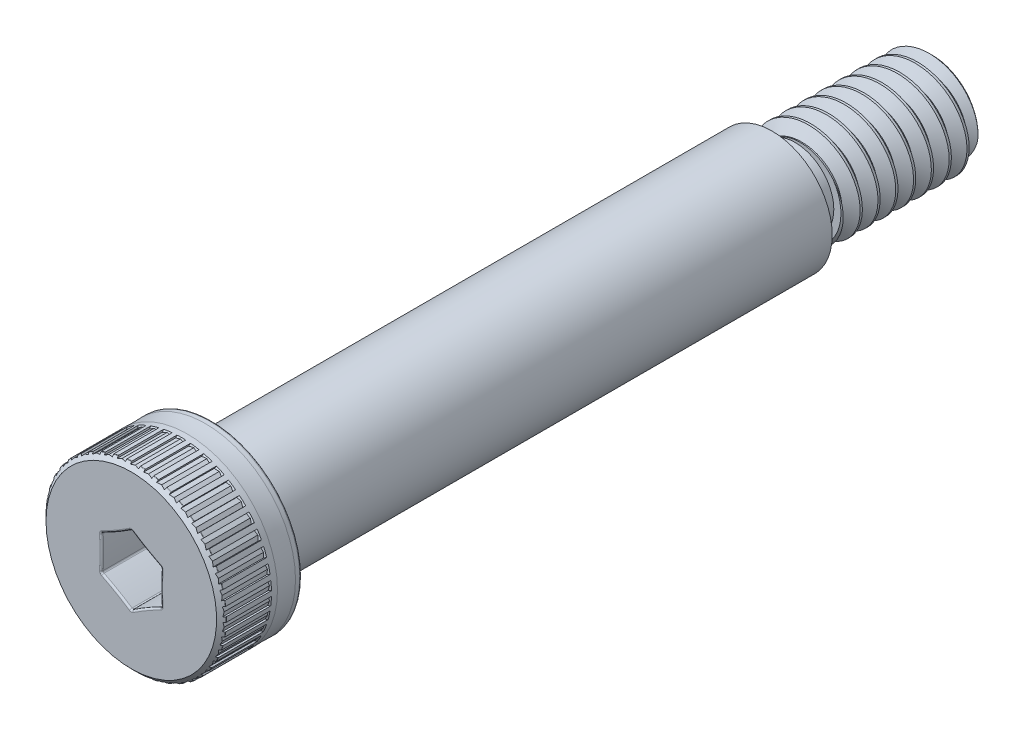
from build123d import *

# Parameters (mm, degrees)
SKETCH4_W             = 1.5875
SKETCH4_H             = 0.47625
SKETCH4_W_2           = 1.834444444
SKETCH4_H_2           = 0.916543552
CHAMFER1_SIZE         = 0.47625
FILLET1_R             = 0.28575
FILLET2_R             = 0.282222222
CHAMFER2_SIZE         = 0.352777778
CHAMFER3_SIZE         = 0.381
CUT_EXTRUDE1_DEPTH    = 3.9751
FILLET4_R             = 0.142875
DELETEFACE1_START     = -46.284444444
DELETEFACE1_OUTLINE_W = 10
DELETEFACE1_OUTLINE_H = 10
DELETEFACE1_OUTLINE_R = 3.058556448
DELETEFACE1_DEPTH     = 0.282222322
CUT_SWEEP1_PITCH      = 1.411111111
CUT_EXTRUDE2_REACH    = 66.299
CIRPATTERN1_COUNT     = 42
FILLET5_R             = 0.0508


# Read off the part's stored shape, not the designer's step: DeleteFace1, CirPattern2
with BuildPart() as part:
    # Sketch3 → Revolve1 (revolve)
    with BuildSketch(Plane(origin=(0, 0, 0), x_dir=(0, 0, -1), z_dir=(1, 0, 0)), mode=Mode.PRIVATE) as revolve1_sk:
        Polygon((-6.35, 7.14375), (0, 7.14375), (0, 4.7625), (44.45, 4.7625), (44.45, 3.9751), (57.15, 3.9751), (57.15, 0), (-6.35, 0), align=None)
    revolve(revolve1_sk.sketch.rotate(Axis((0, 0, 6.35), (0, 0, -1)), 90), axis=Axis((0, 0, 6.35), (0, 0, -1)))

    # Sketch4 → Cut-Revolve1 (revolve, cut)
    with BuildSketch(Plane(origin=(0, 0, 0), x_dir=(0, 0, -1), z_dir=(1, 0, 0)), mode=Mode.PRIVATE) as cut_revolve1_sk:
        with Locations((0.79375, 4.524375)):
            Rectangle(SKETCH4_W, SKETCH4_H)
        with Locations((45.367222222, 3.516828224)):
            Rectangle(SKETCH4_W_2, SKETCH4_H_2)
    revolve(cut_revolve1_sk.sketch.rotate(Axis((0, 0, 6.35), (0, 0, -1)), 90), axis=Axis((0, 0, 6.35), (0, 0, -1)), mode=Mode.SUBTRACT)

    # Chamfer1
    chamfer1_edges = [part.edges().sort_by_distance(p)[0] for p in [
        (-4.28625, 0, -1.5875),
    ]]
    chamfer(chamfer1_edges, length=CHAMFER1_SIZE - 0.0001)  # a hair under: the kernel refuses the full size

    # Fillet1
    fillet1_edges = [part.edges().sort_by_distance(p)[0] for p in [
        (-4.28625, 0, 0),
    ]]
    fillet(fillet1_edges, radius=FILLET1_R)

    # Fillet2
    fillet2_edges = [part.edges().sort_by_distance(p)[0] for p in [
        (-3.058556448, 0, -44.45),
        (-3.058556448, 0, -46.284444444),
    ]]
    fillet(fillet2_edges, radius=FILLET2_R)

    # Chamfer2
    chamfer2_edges = [part.edges().sort_by_distance(p)[0] for p in [
        (-3.9751, 0, -46.284444444),
        (-3.9751, 0, -57.15),
    ]]
    chamfer(chamfer2_edges, length=CHAMFER2_SIZE)

    # Chamfer3
    chamfer3_edges = [part.edges().sort_by_distance(p)[0] for p in [
        (-7.14375, 0, 6.35),
    ]]
    chamfer(chamfer3_edges, length=CHAMFER3_SIZE)

    # Sketch5 → Cut-Extrude1 (cut)
    with BuildSketch(Plane.XY.offset(6.35)):
        with BuildLine():
            ThreePointArc((2.38125, 1.374815329), (1.1668125, 2.020978533), (0, 2.749630657))
            ThreePointArc((0, 2.749630657), (-1.1668125, 2.020978533), (-2.38125, 1.374815329))
            ThreePointArc((-2.38125, 1.374815329), (-2.333625, 0), (-2.38125, -1.374815329))
            ThreePointArc((-2.38125, -1.374815329), (-1.1668125, -2.020978533), (0, -2.749630657))
            ThreePointArc((0, -2.749630657), (1.1668125, -2.020978533), (2.38125, -1.374815329))
            ThreePointArc((2.38125, -1.374815329), (2.333625, 0), (2.38125, 1.374815329))
        make_face()
    extrude(amount=-CUT_EXTRUDE1_DEPTH, mode=Mode.SUBTRACT)

    # Fillet4
    fillet4_edges = [part.edges().sort_by_distance(p)[0] for p in [
        (2.333625, 0, 2.3749),
        (2.38125, 1.374815329, 4.36245),
        (1.1668125, -2.020978533, 2.3749),
        (2.38125, -1.374815329, 4.36245),
        (-1.1668125, -2.020978533, 2.3749),
        (0, -2.749630657, 4.36245),
        (-2.333625, 0, 2.3749),
        (-2.38125, -1.374815329, 4.36245),
        (-1.1668125, 2.020978533, 2.3749),
        (-2.38125, 1.374815329, 4.36245),
        (1.1668125, 2.020978533, 2.3749),
        (0, 2.749630657, 4.36245),
        (2.333625, 0, 6.35),
        (1.1668125, 2.020978533, 6.35),
        (-1.1668125, 2.020978533, 6.35),
        (-2.333625, 0, 6.35),
        (-1.1668125, -2.020978533, 6.35),
        (1.1668125, -2.020978533, 6.35),
        (-7.14375, 0, 0),
    ]]
    fillet(fillet4_edges, radius=FILLET4_R)

    # DeleteFace1 outline → DeleteFace1 (cut)
    with BuildSketch(Plane.XY.offset(DELETEFACE1_START)):
        Rectangle(DELETEFACE1_OUTLINE_W, DELETEFACE1_OUTLINE_H)
        Circle(DELETEFACE1_OUTLINE_R, mode=Mode.SUBTRACT)
    extrude(amount=DELETEFACE1_DEPTH, mode=Mode.SUBTRACT)

    # Cut-Sweep1: the profile of Sketch7 profile screwed along a right-hand helix of 8.48 turns, 8 arcs to a turn; built about Z, then put on its axis
    cut_sweep1_z = Axis((0, 0, 0), (0, 0, 1))
    cut_sweep1_corners = [(4.051478629, 0, 0.044097222), (4.051478629, 0, -1.278819444), (3.058256448, 0, -0.70538235), (3.058256448, 0, -0.529339872)]
    with BuildLine(mode=Mode.PRIVATE) as cut_sweep1_profile:
        Line(cut_sweep1_corners[0], cut_sweep1_corners[1])
        Line(cut_sweep1_corners[1], cut_sweep1_corners[2])
        Line(cut_sweep1_corners[2], cut_sweep1_corners[3])
        Line(cut_sweep1_corners[3], cut_sweep1_corners[0])
    cut_sweep1_cap = Face(cut_sweep1_profile.wire())
    cut_sweep1_turn_angles = [0, 22.5, 45, 67.5, 90, 112.5, 135, 157.5, 180, 202.5, 225, 247.5, 270, 292.5, 315, 337.5, 360]
    cut_sweep1_turn_weights = [1, 0.9238795325112867, 1, 0.9238795325112867, 1, 0.9238795325112867, 1, 0.9238795325112867, 1, 0.9238795325112867, 1, 0.9238795325112867, 1, 0.9238795325112867, 1, 0.9238795325112867, 1]
    cut_sweep1_turn_rails = [Edge.make_bspline([Vector(p[0], p[1], 0).rotate(cut_sweep1_z, cut_sweep1_turn_angles[k]) / cut_sweep1_turn_weights[k] + Vector(0, 0, p[2] + CUT_SWEEP1_PITCH * cut_sweep1_turn_angles[k] / 360) for k in range(17)], [0, 0, 0, 1, 1, 2, 2, 3, 3, 4, 4, 5, 5, 6, 6, 7, 7, 8, 8, 8], 2, cut_sweep1_turn_weights) for p in cut_sweep1_corners]
    cut_sweep1_turn_sides = [Face.make_surface_from_curves(cut_sweep1_turn_rails[p[0]], cut_sweep1_turn_rails[p[1]]) for p in [(0, 1), (1, 2), (2, 3), (3, 0)]]
    cut_sweep1_last_angles = [2880, 2902.5, 2925, 2947.5, 2970, 2992.5, 3015, 3033.9, 3052.8]
    cut_sweep1_last_weights = [1, 0.9238795325112867, 1, 0.9238795325112867, 1, 0.9238795325112867, 1, 0.9460853588276014, 1]
    cut_sweep1_last_rails = [Edge.make_bspline([Vector(p[0], p[1], 0).rotate(cut_sweep1_z, cut_sweep1_last_angles[k]) / cut_sweep1_last_weights[k] + Vector(0, 0, p[2] + CUT_SWEEP1_PITCH * cut_sweep1_last_angles[k] / 360) for k in range(9)], [0, 0, 0, 1, 1, 2, 2, 3, 3, 4, 4, 4], 2, cut_sweep1_last_weights) for p in cut_sweep1_corners]
    cut_sweep1_last_sides = [Face.make_surface_from_curves(cut_sweep1_last_rails[p[0]], cut_sweep1_last_rails[p[1]]) for p in [(0, 1), (1, 2), (2, 3), (3, 0)]]
    cut_sweep1 = Plane(origin=(0, 0, -57.15), x_dir=(0, 1, 0), z_dir=(0, 0, 1)) * Solid(Shell([*[p.moved(Location((0, 0, CUT_SWEEP1_PITCH * i))) for i in range(8) for p in cut_sweep1_turn_sides], *cut_sweep1_last_sides, cut_sweep1_cap, cut_sweep1_cap.rotate(cut_sweep1_z, 3052.8).moved(Location((0, 0, CUT_SWEEP1_PITCH * 3052.8 / 360)))]))
    add(cut_sweep1, mode=Mode.SUBTRACT)

    # Cut-Extrude2: up to this plane
    cut_extrude2_end = Plane(origin=(0, 8.546915019, 0.978084981), z_dir=(0, 0.707106781186546, 0.7071067811865491))
    # Sketch8 → Cut-Extrude2 (cut, up to the surface)
    with BuildSketch(Plane.XY.offset(6.35), mode=Mode.PRIVATE) as cut_extrude2_sk1:
        Polygon((-0.3429, 7.14375), (0.3429, 7.14375), (0.328483903, 7.00659), (0, 7.07517), (-0.328483903, 7.00659), align=None)
    cut_extrude2_tool1 = split(extrude(cut_extrude2_sk1.sketch, amount=-CUT_EXTRUDE2_REACH, mode=Mode.PRIVATE), bisect_by=cut_extrude2_end, keep=Keep.BOTH, mode=Mode.PRIVATE)
    cut_extrude2 = cut_extrude2_tool1.solids().sort_by_distance((0, 7.090627, 6.35))[0]
    add(cut_extrude2, mode=Mode.SUBTRACT)

    # CirPattern1: Cut-Extrude2 ×42 about axis
    cirpattern1_axis = Axis((0, 0, 0), (0, 0, 1))
    for i in range(1, CIRPATTERN1_COUNT):
        add(cut_extrude2.rotate(cirpattern1_axis, i * 360 / CIRPATTERN1_COUNT), mode=Mode.SUBTRACT)

    # Fillet5
    fillet5_edges = [part.edges().sort_by_distance(p)[0] for p in [
        (0.533853106, 7.123774626, 5.969),
    ]]
    fillet(fillet5_edges, radius=FILLET5_R)

    # CirPattern2 outline → CirPattern2 (revolve, cut)
    with BuildSketch(Plane.XZ):
        with BuildLine():
            ThreePointArc((7.128871024, 5.983878976), (7.13988308, 5.96739827), (7.14375, 5.947957951))
            Line((7.14375, 5.947957951), (7.14375, 5.983878976))
            Line((7.14375, 5.983878976), (7.128871024, 5.983878976))
        make_face()
    revolve(axis=Axis((0, 0, 0), (0, 0, 1)), mode=Mode.SUBTRACT)

    # Sketch11 → Cut-Revolve6 (revolve, cut)
    with BuildSketch(Plane(origin=(0, 0, 0), x_dir=(0, 0, -1), z_dir=(1, 0, 0)), mode=Mode.PRIVATE) as cut_revolve6_sk:
        with BuildLine():
            Line((-1.905, 7.14375), (-0.47625, 7.14375))
            ThreePointArc((-0.47625, 7.14375), (-1.190625, 7.12597), (-1.905, 7.14375))
        make_face()
    revolve(cut_revolve6_sk.sketch.rotate(Axis((0, 0, 6.35), (0, 0, -1)), 90), axis=Axis((0, 0, 6.35), (0, 0, -1)), mode=Mode.SUBTRACT)


solid = part.part
